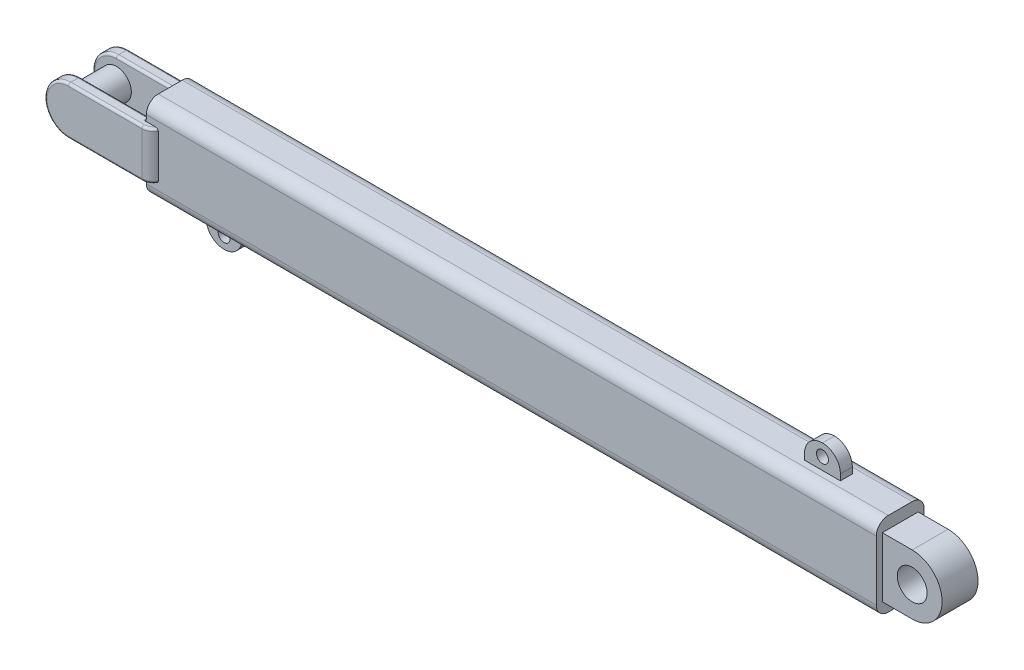
from build123d import *

# Parameters (mm, degrees)
BOSS_EXTRUDE1_DEPTH      = 25
BOSS_EXTRUDE1_DEPTH_BACK = 25
SKETCH2_W                = 30
SKETCH2_H                = 40
CUT_EXTRUDE1_DEPTH       = 96.524865873
BOSS_EXTRUDE2_REACH      = 90.318
SKETCH3_R                = 12.5
STRUCTURAL_MEMBER1_DEPTH = 600
BOSS_EXTRUDE3_DEPTH      = 10
BOSS_EXTRUDE4_DEPTH      = 50
BOSS_EXTRUDE4_DEPTH_BACK = 10
CUT_EXTRUDE6_START       = -30
CUT_EXTRUDE6_DEPTH       = 30
SKETCH16_R               = 12.5
CUT_EXTRUDE7_DEPTH       = 722.959140118
FILLET1_R                = 10
FILLET2_R                = 2
FILLET3_R                = 2
SKETCH19_W               = 30
SKETCH19_H               = 10
BOSS_EXTRUDE6_DEPTH      = 20
FILLET5_R                = 15
SKETCH20_R               = 5
CUT_EXTRUDE9_DEPTH       = 10
LPATTERN1_COUNT          = 2
LPATTERN1_PITCH          = 500
FILLET5_OF_LPATTERN1_R   = 15
MIRROR1_START            = -5
MIRROR1_OUTLINE_R        = 5
MIRROR1_DEPTH            = 10
CUT_EXTRUDE10_START      = -25
CUT_EXTRUDE10_OUTLINE_R  = 5
CUT_EXTRUDE10_DEPTH      = 10
CUT_EXTRUDE11_DEPTH      = 724.498445063
CUT_EXTRUDE11_DEPTH_BACK = 724.498445063


# Read off the part's stored shape, not the designer's step: Cut-Extrude6, Mirror1, Cut-Extrude10
# Some blends are built 0.0001 mm under size
with BuildPart() as part:
    # Sketch1 → Boss-Extrude1 (new, two sides: drawn at the far end of the back side and taken through both)
    with BuildSketch(Plane.XY.offset(-BOSS_EXTRUDE1_DEPTH_BACK)):
        with BuildLine():
            Line((0, 20), (70, 20))
            Line((70, 20), (70, -20))
            Line((70, -20), (0, -20))
            ThreePointArc((0, -20), (-20, 0), (0, 20))
        make_face()
    extrude(amount=BOSS_EXTRUDE1_DEPTH + BOSS_EXTRUDE1_DEPTH_BACK)

    # Sketch2 → Cut-Extrude1 (cut, through all)
    with BuildSketch(Plane(origin=(70, 0, 0), x_dir=(0, 0, -1), z_dir=(1, 0, 0))):
        Rectangle(SKETCH2_W, SKETCH2_H)
    extrude(amount=-CUT_EXTRUDE1_DEPTH, mode=Mode.SUBTRACT)


with BuildPart() as cut_extrude1_piece_1:
    # of the separate pieces the step leaves, piece 1, a body of its own (cut_extrude1_pieces)
    add(part.part.solids().sort_by_distance((0, 20, -25))[0])

    # Sketch3 → Boss-Extrude2 (add, up to next)
    with BuildSketch(Plane.XY.offset(25), mode=Mode.PRIVATE) as boss_extrude2_sk1:
        Circle(SKETCH3_R)
    boss_extrude2_tool1 = extrude(boss_extrude2_sk1.sketch, amount=-BOSS_EXTRUDE2_REACH, mode=Mode.PRIVATE) - cut_extrude1_piece_1.part


with BuildPart() as cut_extrude1_piece_2:
    # of the separate pieces the step leaves, piece 2, a body of its own (cut_extrude1_pieces)
    add(part.part.solids().sort_by_distance((0, 20, 15))[0])


with BuildPart() as cut_extrude1_piece_1_1:
    add(cut_extrude1_piece_1.part)

    add(cut_extrude1_piece_2.part)  # Boss-Extrude2 merges Cut-Extrude1 piece 2
    add(boss_extrude2_tool1.solids().sort_by_distance((0, 0, 25))[0])



with BuildPart() as body_2:
    # Sketch11 → Structural Member1 (new body)
    with BuildSketch(Plane(origin=(70, 0, 0), x_dir=(0, 0, 1), z_dir=(1, 0, 0))):
        with BuildLine():
            Line((-10, -35), (10, -35))
            ThreePointArc((10, -35), (17.071067812, -32.071067812), (20, -25))
            Line((20, -25), (20, 25))
            ThreePointArc((20, 25), (17.071067812, 32.071067812), (10, 35))
            Line((10, 35), (-10, 35))
            ThreePointArc((-10, 35), (-17.071067812, 32.071067812), (-20, 25))
            Line((-20, 25), (-20, -25))
            ThreePointArc((-20, -25), (-17.071067812, -32.071067812), (-10, -35))
        make_face()
        with BuildLine():
            Line((-10, -30), (10, -30))
            ThreePointArc((10, -30), (13.535533906, -28.535533906), (15, -25))
            Line((15, -25), (15, 25))
            ThreePointArc((15, 25), (13.535533906, 28.535533906), (10, 30))
            Line((10, 30), (-10, 30))
            ThreePointArc((-10, 30), (-13.535533906, 28.535533906), (-15, 25))
            Line((-15, 25), (-15, -25))
            ThreePointArc((-15, -25), (-13.535533906, -28.535533906), (-10, -30))
        make_face(mode=Mode.SUBTRACT)
    extrude(amount=STRUCTURAL_MEMBER1_DEPTH)


with BuildPart() as cut_extrude1_piece_1_2:
    add(cut_extrude1_piece_1_1.part)

    add(body_2.part)  # Boss-Extrude3 merges body 2
    # Sketch12 → Boss-Extrude3 (add)
    with BuildSketch(Plane.ZY.offset(-70)):
        with BuildLine():
            Line((20, -25), (20, 25))
            ThreePointArc((20, 25), (17.071067812, 32.071067812), (10, 35))
            Line((10, 35), (-10, 35))
            ThreePointArc((-10, 35), (-17.071067812, 32.071067812), (-20, 25))
            Line((-20, 25), (-20, -25))
            ThreePointArc((-20, -25), (-17.071067812, -32.071067812), (-10, -35))
            Line((-10, -35), (10, -35))
            ThreePointArc((10, -35), (17.071067812, -32.071067812), (20, -25))
        make_face()
    extrude(amount=BOSS_EXTRUDE3_DEPTH)

    # Sketch14 → Boss-Extrude4 (add, two sides: drawn at the far end of the back side and taken through both)
    with BuildSketch(Plane(origin=(670, 0, 0), x_dir=(0, 0, -1), z_dir=(1, 0, 0)).offset(-BOSS_EXTRUDE4_DEPTH_BACK)):
        with BuildLine():
            Line((15, -25), (15, 25))
            ThreePointArc((15, 25), (13.535533906, 28.535533906), (10, 30))
            Line((10, 30), (-10, 30))
            ThreePointArc((-10, 30), (-13.535533906, 28.535533906), (-15, 25))
            Line((-15, 25), (-15, -25))
            ThreePointArc((-15, -25), (-13.535533906, -28.535533906), (-10, -30))
            Line((-10, -30), (10, -30))
            ThreePointArc((10, -30), (13.535533906, -28.535533906), (15, -25))
        make_face()
    extrude(amount=BOSS_EXTRUDE4_DEPTH + BOSS_EXTRUDE4_DEPTH_BACK)

    # Cut-Extrude6 outline → Cut-Extrude6 (cut)
    with BuildSketch(Plane.XY.offset(15).offset(CUT_EXTRUDE6_START)):
        with BuildLine():
            Line((670, -25), (670, -30))
            Line((670, -30), (720, -30))
            Line((720, -30), (720, 1.37e-07))
            ThreePointArc((720, 1.37e-07), (712.677669578, -17.677669481), (695, -25))
            Line((695, -25), (670, -25))
        make_face()
        with BuildLine():
            Line((670, 30), (670, 25))
            Line((670, 25), (695, 25))
            ThreePointArc((695, 25), (712.677669481, 17.677669578), (720, 1.37e-07))
            Line((720, 1.37e-07), (720, 30))
            Line((720, 30), (670, 30))
        make_face()
    extrude(amount=CUT_EXTRUDE6_DEPTH, mode=Mode.SUBTRACT)

    # Sketch16 → Cut-Extrude7 (cut, through all)
    with BuildSketch(Plane.XY.offset(15)):
        with Locations((695, 0)):
            Circle(SKETCH16_R)
    extrude(amount=-CUT_EXTRUDE7_DEPTH, mode=Mode.SUBTRACT)

    # Fillet1
    # the kernel refuses this fillet: 10 mm, written as the material it takes off along each edge
    with BuildSketch(Plane(origin=(70, 41.650635095, -25), x_dir=(0, 0, 1), z_dir=(0, -1, 0))) as fillet1_piece_1:
        with BuildLine():
            CenterArc((10, 8.660254038), FILLET1_R, 180, 60)
            Line((0, 8.660254038), (-0.2, 8.660254038))
            Line((-0.2, 8.660254038), (-0.2, 0))
            Line((-0.2, 0), (0, -0.2))
            ThreePointArc((0, -0.2), (2.5, -0.2), (4.9, -0.173205081))
            Line((4.9, -0.173205081), (5, 0))
        make_face()
    extrude(amount=83.301270189, mode=Mode.SUBTRACT)
    with BuildSketch(Plane(origin=(70, 41.650635095, 25), x_dir=(0, 0, -1), z_dir=(0, -1, 0))) as fillet1_piece_2:
        with BuildLine():
            CenterArc((10, -8.660254038), FILLET1_R, 120, 60)
            Line((0, -8.660254038), (-0.2, -8.660254038))
            Line((-0.2, -8.660254038), (-0.2, 0))
            Line((-0.2, 0), (0, 0.2))
            ThreePointArc((0, 0.2), (2.5, 0.2), (4.9, 0.173205081))
            Line((4.9, 0.173205081), (5, 0))
        make_face()
    extrude(amount=83.301270189, mode=Mode.SUBTRACT)

    # Fillet2
    fillet2_edges = [cut_extrude1_piece_1_2.edges().sort_by_distance(p)[0] for p in [
        (-12.5, 0, 15),
        (30, 20, -15),
        (-20, 0, -15),
        (30, -20, -15),
        (-20, 0, 15),
        (30, 20, 15),
        (60, 0, -15),
        (30, -20, 15),
        (60, 0, 15),
        (60, 20, 17.5),
        (60, 20, -17.5),
        (60, -20, -17.5),
        (60, -20, 17.5),
    ]]
    fillet(fillet2_edges, radius=FILLET2_R)

    # Fillet3
    fillet3_edges = [cut_extrude1_piece_1_2.edges().sort_by_distance(p)[0] for p in [
        (66.339745962, 20, 23.660254038),
        (30.669872981, 20, 25),
        (-20, 0, 25),
        (66.339745962, -20, 23.660254038),
        (66.339745962, 20, -23.660254038),
        (30.669872981, 20, -25),
        (-20, 0, -25),
        (66.339745962, -20, -23.660254038),
        (30.669872981, -20, 25),
        (30.669872981, -20, -25),
    ]]
    fillet(fillet3_edges, radius=FILLET3_R)


with BuildPart() as body_2_2:
    # Sketch19 → Boss-Extrude6 (new body)
    with BuildSketch(Plane.XZ.offset(35)):
        with Locations((110, 0)):
            Rectangle(SKETCH19_W, SKETCH19_H)
    boss_extrude6 = extrude(amount=BOSS_EXTRUDE6_DEPTH)

    # Fillet5
    fillet5_edges = [body_2_2.edges().sort_by_distance(p)[0] for p in [
        (95, -55, 0),
        (125, -55, 0),
    ]]
    fillet(fillet5_edges, radius=FILLET5_R - 0.0001)  # a hair under: the kernel refuses the full size

    # Sketch20 → Cut-Extrude9 (cut)
    with BuildSketch(Plane.XY.offset(5)):
        with Locations((110, -45)):
            Circle(SKETCH20_R)
    cut_extrude9 = extrude(amount=-CUT_EXTRUDE9_DEPTH, mode=Mode.SUBTRACT)


with BuildPart() as cut_extrude1_piece_1_3:
    add(cut_extrude1_piece_1_2.part)

    # LPattern1: Boss-Extrude6, Cut-Extrude9 ×2
    with Locations(*[(i * LPATTERN1_PITCH, 0, 0) for i in range(1, LPATTERN1_COUNT)]):
        add(boss_extrude6)
        add(cut_extrude9, mode=Mode.SUBTRACT)

    # Fillet5 of LPattern1
    fillet5_of_lpattern1_edges = [cut_extrude1_piece_1_3.edges().sort_by_distance(p)[0] for p in [
        (595, -55, 0),
        (625, -55, 0),
    ]]
    fillet(fillet5_of_lpattern1_edges, radius=FILLET5_OF_LPATTERN1_R - 0.0001)  # a hair under: the kernel refuses the full size

    # Mirror1 outline → Mirror1 (add)
    # profile 1 of 2: a face of its own
    with BuildSketch(Plane.XY.offset(MIRROR1_START)):
        with BuildLine():
            Line((595, 40), (595, 35))
            Line((595, 35), (625, 35))
            Line((625, 35), (625, 40))
            ThreePointArc((625, 40), (620.606601718, 50.606601718), (610, 55))
            ThreePointArc((610, 55), (599.393398282, 50.606601718), (595, 40))
        make_face()
        with Locations((610, 45)):
            Circle(MIRROR1_OUTLINE_R, mode=Mode.SUBTRACT)
    # profile 2 of 2: a face of its own
    with BuildSketch(Plane.XY.offset(MIRROR1_START)):
        with BuildLine():
            Line((125, 35), (125, 40))
            ThreePointArc((125, 40), (120.606601718, 50.606601718), (110, 55))
            ThreePointArc((110, 55), (99.393398282, 50.606601718), (95, 40))
            Line((95, 40), (95, 35))
            Line((95, 35), (125, 35))
        make_face()
        with Locations((110, 45)):
            Circle(MIRROR1_OUTLINE_R, mode=Mode.SUBTRACT)
    extrude(amount=MIRROR1_DEPTH)

    # Cut-Extrude10 outline → Cut-Extrude10 (cut)
    with BuildSketch(Plane.XY.offset(20).offset(CUT_EXTRUDE10_START)):
        with BuildLine():
            Line((95, 40), (95, 35))
            Line((95, 35), (125, 35))
            Line((125, 35), (125, 40))
            ThreePointArc((125, 40), (120.606601718, 50.606601718), (110, 55))
            ThreePointArc((110, 55), (99.393398282, 50.606601718), (95, 40))
        make_face()
        with Locations((110, 45)):
            Circle(CUT_EXTRUDE10_OUTLINE_R, mode=Mode.SUBTRACT)
    extrude(amount=CUT_EXTRUDE10_DEPTH, mode=Mode.SUBTRACT)

    # Sketch22 → Cut-Extrude11 (cut, two sides: drawn at the far end of the back side and taken through both)
    with BuildSketch(Plane.XY.offset(20).offset(-CUT_EXTRUDE11_DEPTH_BACK)):
        Polygon((1937.497600964, -35), (625, -35), (594.75712703, -35), (-717.740473933, -35), (-717.740473933, -2659.995201927), (1937.497600964, -2659.995201927), align=None)
    extrude(amount=CUT_EXTRUDE11_DEPTH + CUT_EXTRUDE11_DEPTH_BACK, mode=Mode.SUBTRACT)


solid = Compound([body_2_2.part, cut_extrude1_piece_1_3.part])
